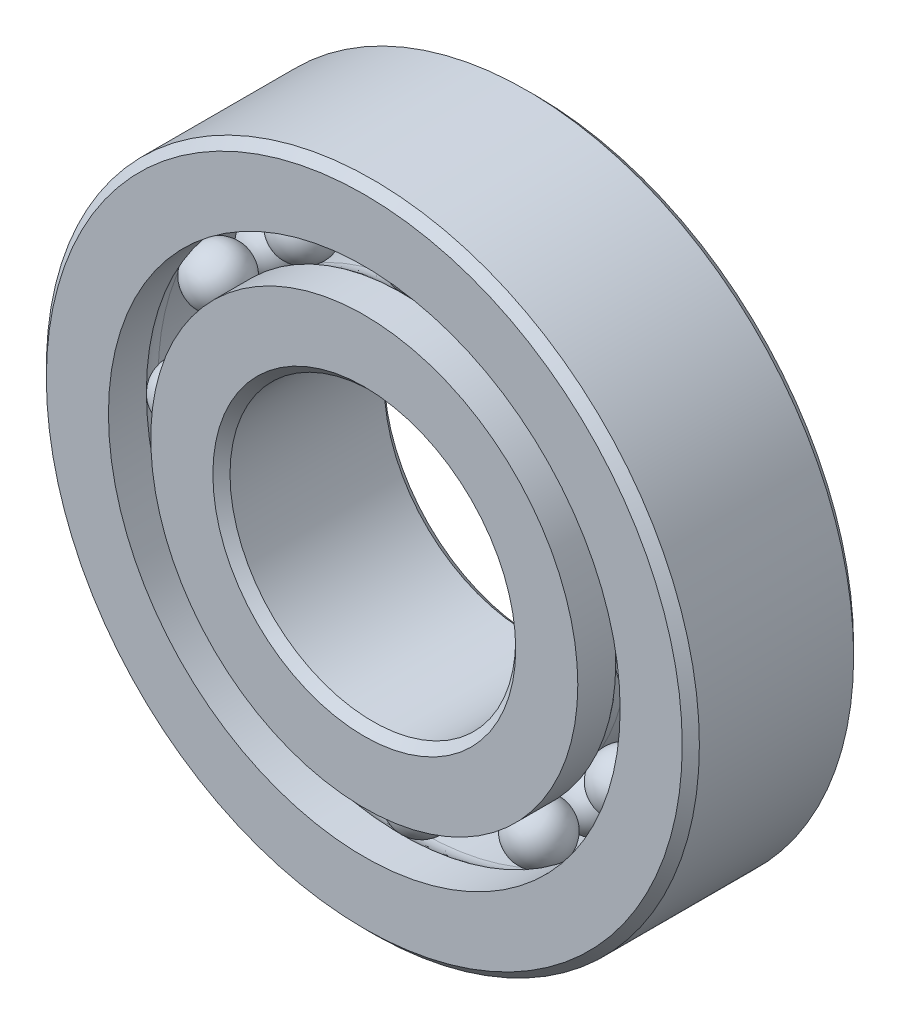
from build123d import *

# Parameters (mm, degrees)
CIRPATTERN1_ANGLE    = 180
CIRPATTERN1_2_ANGLE  = 180
CIRPATTERN1_3_ANGLE  = 180
CIRPATTERN1_4_ANGLE  = 180
CIRPATTERN1_5_ANGLE  = 180
CIRPATTERN1_6_ANGLE  = 180
CIRPATTERN1_7_ANGLE  = 180
CIRPATTERN1_8_ANGLE  = 180
CIRPATTERN1_9_ANGLE  = 180
CIRPATTERN1_10_ANGLE = 180
CIRPATTERN1_11_ANGLE = 180
CIRPATTERN1_12_ANGLE = 30
CIRPATTERN1_13_ANGLE = 60
CIRPATTERN1_14_ANGLE = 90
CIRPATTERN1_15_ANGLE = 120
CIRPATTERN1_16_ANGLE = 150
CIRPATTERN1_17_ANGLE = 180
CIRPATTERN1_18_ANGLE = 150
CIRPATTERN1_19_ANGLE = 120
CIRPATTERN1_20_ANGLE = 90
CIRPATTERN1_21_ANGLE = 60
CIRPATTERN1_22_ANGLE = 30


with BuildPart() as part:
    # Sketch1 → Revolve1 (revolve)
    with BuildSketch(Plane(origin=(0, 0, 0), x_dir=(0, 0, -1), z_dir=(1, 0, 0)), mode=Mode.PRIVATE) as revolve1_sk:
        with BuildLine():
            Line((9.45, 40), (-9.45, 40))
            Line((-9.45, 40), (-10.5, 38.95))
            Line((-10.5, 38.95), (-10.5, 31.343406593))
            Line((-10.5, 31.343406593), (-5.85037066, 31.343406593))
            ThreePointArc((-5.85037066, 31.343406593), (-4.759578684, 32.015495604), (-3.5, 32.25))
            Line((-3.5, 32.25), (3.5, 32.25))
            ThreePointArc((3.5, 32.25), (4.759578684, 32.015495604), (5.85037066, 31.343406593))
            Line((5.85037066, 31.343406593), (10.5, 31.343406593))
            Line((10.5, 31.343406593), (10.5, 38.95))
            Line((10.5, 38.95), (9.45, 40))
        make_face()
    revolve(revolve1_sk.sketch.rotate(Axis((0, 0, 10.5), (0, 0, -1)), 90), axis=Axis((0, 0, 10.5), (0, 0, -1)))


with BuildPart() as body_2:
    # Sketch3 → Revolve3 (revolve)
    with BuildSketch(Plane(origin=(0, 0, 0), x_dir=(0, 0, -1), z_dir=(1, 0, 0)), mode=Mode.PRIVATE) as revolve3_sk:
        with BuildLine():
            Line((-10.5, 26.156593407), (-5.85037066, 26.156593407))
            ThreePointArc((-5.85037066, 26.156593407), (-4.759578684, 25.484504396), (-3.5, 25.25))
            Line((-3.5, 25.25), (3.5, 25.25))
            ThreePointArc((3.5, 25.25), (4.759578684, 25.484504396), (5.85037066, 26.156593407))
            Line((5.85037066, 26.156593407), (10.5, 26.156593407))
            Line((10.5, 26.156593407), (10.5, 18.55))
            Line((10.5, 18.55), (9.45, 17.5))
            Line((9.45, 17.5), (-9.45, 17.5))
            Line((-9.45, 17.5), (-10.5, 18.55))
            Line((-10.5, 18.55), (-10.5, 26.156593407))
        make_face()
    revolve(revolve3_sk.sketch.rotate(Axis((0, 0, 10.5), (0, 0, -1)), 90), axis=Axis((0, 0, 10.5), (0, 0, -1)))


with BuildPart() as body_3:
    # Sketch4 → Revolve4 (revolve)
    with BuildSketch(Plane(origin=(0, 0, 0), x_dir=(0, 0, -1), z_dir=(1, 0, 0))):
        with BuildLine():
            Line((0, 28.75), (7, 28.75))
            ThreePointArc((7, 28.75), (3.5, 32.25), (0, 28.75))
        make_face()
    revolve(axis=Axis((0, 28.75, 0), (0, 0, -1)))


with BuildPart() as body_4:
    # Mirror1: mirrored copy
    add(body_3.part.mirror(Plane.XY))


with BuildPart() as body_5:
    # CirPattern1: read off the stored shape, not the designer's step
    # CirPattern1: copy of body 4
    add(body_4.part.rotate(Axis((0, 0, 0), (0.2588190451, -0.9659258263, 0)), CIRPATTERN1_ANGLE))


with BuildPart() as body_6:
    # CirPattern1 2: copy of body 4
    add(body_4.part.rotate(Axis((0, 0, 0), (0.5, -0.8660254038, 0)), CIRPATTERN1_2_ANGLE))


with BuildPart() as body_7:
    # CirPattern1 3: copy of body 4
    add(body_4.part.rotate(Axis((0, 0, 0), (0.7071067812, -0.7071067812, 0)), CIRPATTERN1_3_ANGLE))


with BuildPart() as body_8:
    # CirPattern1 4: copy of body 4
    add(body_4.part.rotate(Axis((0, 0, 0), (0.8660254038, -0.5, 0)), CIRPATTERN1_4_ANGLE))


with BuildPart() as body_9:
    # CirPattern1 5: copy of body 4
    add(body_4.part.rotate(Axis((0, 0, 0), (0.9659258263, -0.2588190451, 0)), CIRPATTERN1_5_ANGLE))


with BuildPart() as body_10:
    # CirPattern1 6: copy of body 4
    add(body_4.part.rotate(Axis((0, 0, 0), (1, 0, 0)), CIRPATTERN1_6_ANGLE))


with BuildPart() as body_11:
    # CirPattern1 7: copy of body 4
    add(body_4.part.rotate(Axis((0, 0, 0), (0.9659258263, 0.2588190451, 0)), CIRPATTERN1_7_ANGLE))


with BuildPart() as body_12:
    # CirPattern1 8: copy of body 4
    add(body_4.part.rotate(Axis((0, 0, 0), (0.8660254038, 0.5, 0)), CIRPATTERN1_8_ANGLE))


with BuildPart() as body_13:
    # CirPattern1 9: copy of body 4
    add(body_4.part.rotate(Axis((0, 0, 0), (0.7071067812, 0.7071067812, 0)), CIRPATTERN1_9_ANGLE))


with BuildPart() as body_14:
    # CirPattern1 10: copy of body 4
    add(body_4.part.rotate(Axis((0, 0, 0), (0.5, 0.8660254038, 0)), CIRPATTERN1_10_ANGLE))


with BuildPart() as body_15:
    # CirPattern1 11: copy of body 4
    add(body_4.part.rotate(Axis((0, 0, 0), (0.2588190451, 0.9659258263, 0)), CIRPATTERN1_11_ANGLE))


with BuildPart() as body_16:
    # CirPattern1 12: copy of body 4
    add(body_4.part.rotate(Axis((0, 0, 0), (0, 0, 1)), CIRPATTERN1_12_ANGLE))


with BuildPart() as body_17:
    # CirPattern1 13: copy of body 4
    add(body_4.part.rotate(Axis((0, 0, 0), (0, 0, 1)), CIRPATTERN1_13_ANGLE))


with BuildPart() as body_18:
    # CirPattern1 14: copy of body 4
    add(body_4.part.rotate(Axis((0, 0, 0), (0, 0, 1)), CIRPATTERN1_14_ANGLE))


with BuildPart() as body_19:
    # CirPattern1 15: copy of body 4
    add(body_4.part.rotate(Axis((0, 0, 0), (0, 0, 1)), CIRPATTERN1_15_ANGLE))


with BuildPart() as body_20:
    # CirPattern1 16: copy of body 4
    add(body_4.part.rotate(Axis((0, 0, 0), (0, 0, 1)), CIRPATTERN1_16_ANGLE))


with BuildPart() as body_21:
    # CirPattern1 17: copy of body 4
    add(body_4.part.rotate(Axis((0, 0, 0), (0, 0, 1)), CIRPATTERN1_17_ANGLE))


with BuildPart() as body_22:
    # CirPattern1 18: copy of body 4
    add(body_4.part.rotate(Axis((0, 0, 0), (0, 0, -1)), CIRPATTERN1_18_ANGLE))


with BuildPart() as body_23:
    # CirPattern1 19: copy of body 4
    add(body_4.part.rotate(Axis((0, 0, 0), (0, 0, -1)), CIRPATTERN1_19_ANGLE))


with BuildPart() as body_24:
    # CirPattern1 20: copy of body 4
    add(body_4.part.rotate(Axis((0, 0, 0), (0, 0, -1)), CIRPATTERN1_20_ANGLE))


with BuildPart() as body_25:
    # CirPattern1 21: copy of body 4
    add(body_4.part.rotate(Axis((0, 0, 0), (0, 0, -1)), CIRPATTERN1_21_ANGLE))


with BuildPart() as body_26:
    # CirPattern1 22: copy of body 4
    add(body_4.part.rotate(Axis((0, 0, 0), (0, 0, -1)), CIRPATTERN1_22_ANGLE))


solid = Compound([part.part, body_2.part, body_3.part, body_4.part, body_5.part, body_6.part, body_7.part, body_8.part, body_9.part, body_10.part, body_11.part, body_12.part, body_13.part, body_14.part, body_15.part, body_16.part, body_17.part, body_18.part, body_19.part, body_20.part, body_21.part, body_22.part, body_23.part, body_24.part, body_25.part, body_26.part])
